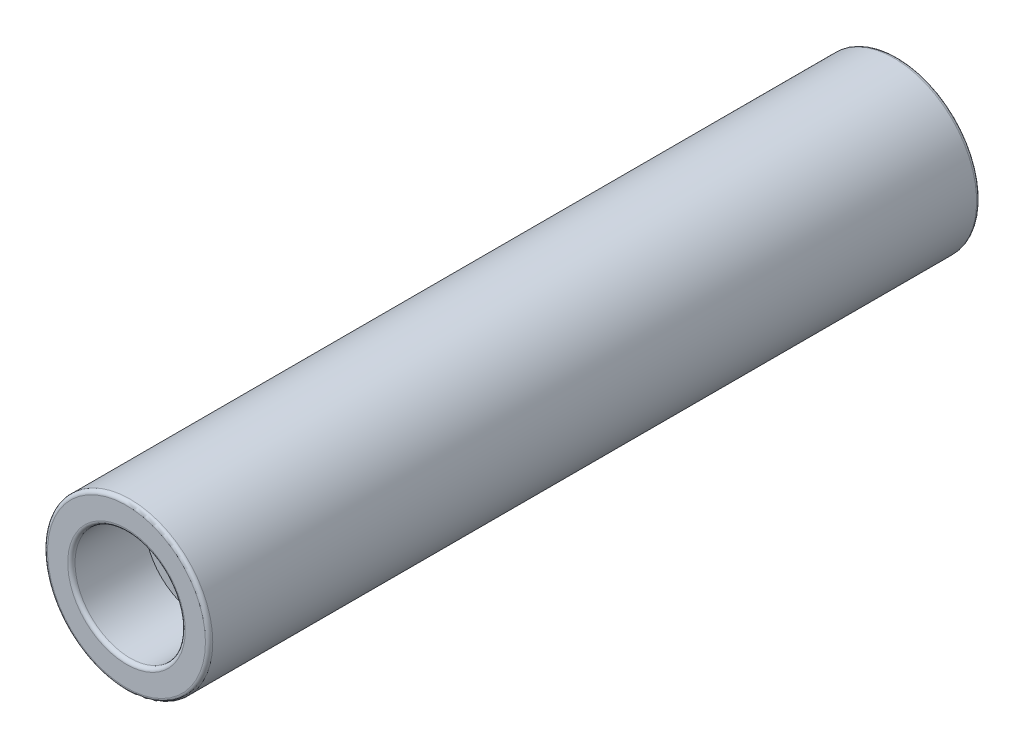
from build123d import *

# Parameters (mm, degrees)
SKETCH1_R           = 4.5
SKETCH1_R_2         = 0.75
EXTRUDE_THIN1_DEPTH = 12
SKETCH11_R          = 4.5
SKETCH11_R_2        = 1.5
EXTRUDE_THIN3_DEPTH = 5
SKETCH12_R          = 4.5
SKETCH12_R_2        = 3
EXTRUDE_THIN4_DEPTH = 4
THREAD1_PITCH       = 0.5
FILLET1_R           = 0.2


with BuildPart() as part:
    # Sketch1 → Extrude-Thin1 (new body)
    with BuildSketch(Plane.XY):
        Circle(SKETCH1_R)
        Circle(SKETCH1_R_2, mode=Mode.SUBTRACT)
    extrude_thin1 = extrude(amount=EXTRUDE_THIN1_DEPTH)

    # Sketch11 → Extrude-Thin3 (add)
    with BuildSketch(Plane.XY.offset(12)):
        Circle(SKETCH11_R)
        Circle(SKETCH11_R_2, mode=Mode.SUBTRACT)
    extrude_thin3 = extrude(amount=EXTRUDE_THIN3_DEPTH)

    # Sketch12 → Extrude-Thin4 (add)
    with BuildSketch(Plane.XY.offset(17)):
        Circle(SKETCH12_R)
        Circle(SKETCH12_R_2, mode=Mode.SUBTRACT)
    extrude_thin4 = extrude(amount=EXTRUDE_THIN4_DEPTH)

    # Thread1: the profile of Thread Profile1 profile screwed along a right-hand helix of 10 turns, 6 arcs to a turn; built about Z, then put on its axis
    thread1_z = Axis((0, 0, 0), (0, 0, 1))
    thread1_corners = [(1.5003, 0, -0.000173205), (1.5003, 0, 0.437673204), (1.229367063, 0, 0.281249999), (1.229367063, 0, 0.156249999)]
    with BuildLine(mode=Mode.PRIVATE) as thread1_profile:
        Line(thread1_corners[0], thread1_corners[1])
        Line(thread1_corners[1], thread1_corners[2])
        Line(thread1_corners[2], thread1_corners[3])
        Line(thread1_corners[3], thread1_corners[0])
    thread1_cap = Face(thread1_profile.wire())
    thread1_turn_angles = [0, 30, 60, 90, 120, 150, 180, 210, 240, 270, 300, 330, 360]
    thread1_turn_weights = [1, 0.8660254037844387, 1, 0.8660254037844387, 1, 0.8660254037844387, 1, 0.8660254037844387, 1, 0.8660254037844387, 1, 0.8660254037844387, 1]
    thread1_turn_rails = [Edge.make_bspline([Vector(p[0], p[1], 0).rotate(thread1_z, thread1_turn_angles[k]) / thread1_turn_weights[k] + Vector(0, 0, p[2] + THREAD1_PITCH * thread1_turn_angles[k] / 360) for k in range(13)], [0, 0, 0, 1, 1, 2, 2, 3, 3, 4, 4, 5, 5, 6, 6, 6], 2, thread1_turn_weights) for p in thread1_corners]
    thread1_turn_sides = [Face.make_surface_from_curves(thread1_turn_rails[p[0]], thread1_turn_rails[p[1]]) for p in [(0, 1), (1, 2), (2, 3), (3, 0)]]
    thread1 = Plane(origin=(0, 0, 12), x_dir=(1, 0, 0), z_dir=(0, 0, 1)) * Solid(Shell([*[p.moved(Location((0, 0, THREAD1_PITCH * i))) for i in range(10) for p in thread1_turn_sides], thread1_cap, thread1_cap.rotate(thread1_z, 3600).moved(Location((0, 0, THREAD1_PITCH * 3600 / 360)))]))
    add(thread1)

    # Mirror2: Extrude-Thin1, Extrude-Thin3, Extrude-Thin4, Thread1 across plane
    add(extrude_thin1.mirror(Plane.XY))
    add(extrude_thin3.mirror(Plane.XY))
    add(extrude_thin4.mirror(Plane.XY))
    add(thread1.mirror(Plane.XY))

    # Fillet1
    fillet1_edges = [part.edges().sort_by_distance(p)[0] for p in [
        (-4.5, 0, 21),
        (-3, 0, 21),
        (-4.5, 0, -21),
        (-3, 0, -21),
    ]]
    fillet(fillet1_edges, radius=FILLET1_R)


solid = part.part
